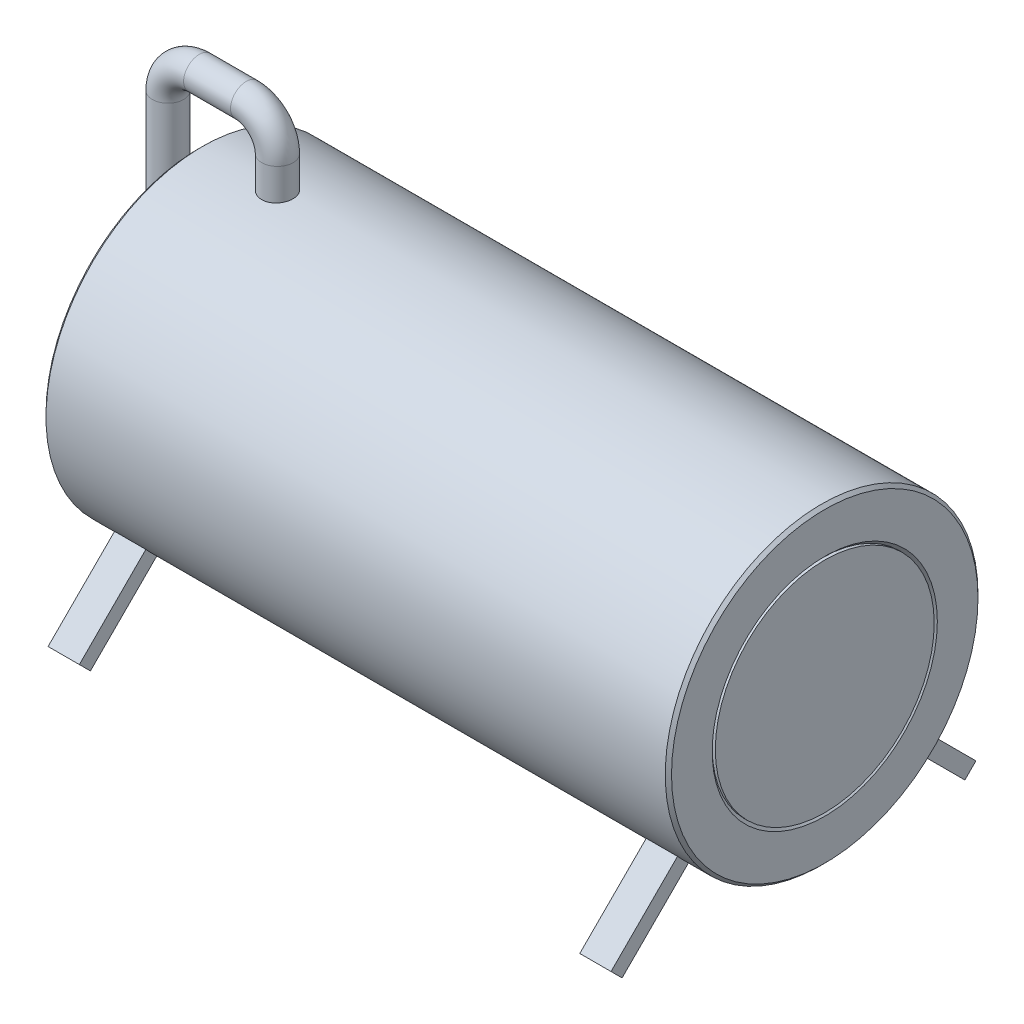
from build123d import *

# Parameters (mm, degrees)
ESBO_O1_R                                     = 50
RESSALTO_EXTRUS_O1_DEPTH                      = 200
ESBO_O2_R                                     = 35
CORTE_EXTRUS_O1_DEPTH                         = 200
ESBO_O3_W                                     = 190
ESBO_O3_H                                     = 10
CHANFRO1_SIZE                                 = 1
RESSALTO_EXTRUS_O2_DEPTH                      = 10
PADR_OCIRCULAR1_COUNT                         = 2
PADR_OCIRCULAR1_ANGLE                         = 90
PADR_O_LINEAR1_COUNT                          = 2
PADR_O_LINEAR1_PITCH                          = 170
PADR_O_LINEAR1_COPY_1_DEPTH                   = 10
BROCA_DE_ROSQUEAR_PARA_TARRAXA_DE_M10X1_REACH = 236.819
BROCA_DE_ROSQUEAR_PARA_TARRAXA_DE_M1_2_R      = 4.5
ESBO_O9_R                                     = 5
ESBO_O9_R_2                                   = 2.5
CHANFRO2_SIZE                                 = 2.5
ESBO_O10_W                                    = 5
ESBO_O10_H                                    = 35
ESBO_O14_W                                    = 5
ESBO_O14_H                                    = 30
SKETCH1_W                                     = 2.57901042
SKETCH1_H                                     = 7.592922652


with BuildPart() as part:
    # Esboço1 → Ressalto-extrusão1 (new body)
    with BuildSketch(Plane(origin=(0, 0, 0), x_dir=(0, 0, -1), z_dir=(1, 0, 0))):
        Circle(ESBO_O1_R)
    extrude(amount=RESSALTO_EXTRUS_O1_DEPTH)

    # Esboço2 → Corte-extrusão1 (cut)
    with BuildSketch(Plane(origin=(200, 0, 0), x_dir=(0, 0, -1), z_dir=(1, 0, 0))):
        Circle(ESBO_O2_R)
    extrude(amount=-CORTE_EXTRUS_O1_DEPTH, mode=Mode.SUBTRACT)

    # Esboço3 → Corte-Revolução1 (revolve, cut)
    with BuildSketch(Plane.XY, mode=Mode.PRIVATE) as corte_revolu_o1_sk:
        with Locations((100, 42.5)):
            Rectangle(ESBO_O3_W, ESBO_O3_H)
    revolve(corte_revolu_o1_sk.sketch.rotate(Axis((200, 0, 0), (-1, 0, 0)), 90), axis=Axis((200, 0, 0), (-1, 0, 0)), mode=Mode.SUBTRACT)

    # Chanfro1
    chanfro1_edges = [part.edges().sort_by_distance(p)[0] for p in [
        (0, 0, 50),
        (200, 0, 50),
        (0, 0, 35),
        (200, 0, 35),
    ]]
    chamfer(chanfro1_edges, length=CHANFRO1_SIZE)

    # Esboço4 → Ressalto-extrusão2 (add)
    with BuildSketch(Plane.ZY.offset(-10)):
        with BuildLine():
            Line((-37.078884183, -33.543350277), (-58.336309448, -54.800775542))
            Line((-58.336309448, -54.800775542), (-54.800775542, -58.336309448))
            Line((-54.800775542, -58.336309448), (-33.543350277, -37.078884183))
            ThreePointArc((-33.543350277, -37.078884183), (-35.355339059, -35.355339059), (-37.078884183, -33.543350277))
        make_face()
    ressalto_extrus_o2 = extrude(amount=-RESSALTO_EXTRUS_O2_DEPTH)

    # PadrãoCircular1: Ressalto-extrusão2 ×2 about axis
    padr_ocircular1_axis = Axis((0, 0, 0), (-1, 0, 0))
    for i in range(1, PADR_OCIRCULAR1_COUNT):
        add(ressalto_extrus_o2.rotate(padr_ocircular1_axis, i * PADR_OCIRCULAR1_ANGLE / (PADR_OCIRCULAR1_COUNT - 1)))

    # Padrão linear1: Ressalto-extrusão2 ×2
    with Locations(*[(i * PADR_O_LINEAR1_PITCH, 0, 0) for i in range(1, PADR_O_LINEAR1_COUNT)]):
        add(ressalto_extrus_o2)

    # Padrão linear1 copy 1 sketch → Padrão linear1 copy 1 (add)
    with BuildSketch(Plane(origin=(180, 0, 0), x_dir=(0, 1, 0), z_dir=(-1, 0, 0))):
        with BuildLine():
            Line((-37.078884183, -33.543350277), (-58.336309448, -54.800775542))
            Line((-58.336309448, -54.800775542), (-54.800775542, -58.336309448))
            Line((-54.800775542, -58.336309448), (-33.543350277, -37.078884183))
            ThreePointArc((-33.543350277, -37.078884183), (-35.355339059, -35.355339059), (-37.078884183, -33.543350277))
        make_face()
    extrude(amount=-PADR_O_LINEAR1_COPY_1_DEPTH)

    # Broca de rosquear para tarraxa de M1 2 → Broca de rosquear para tarraxa de M10x1.01 (cut, up to next)
    with BuildSketch(Plane(origin=(0, 50, 0), x_dir=(-1, 0, 0), z_dir=(0, 1, 0)), mode=Mode.PRIVATE) as broca_de_rosquear_para_tarraxa_de_m10x1_sk1:
        with Locations((-25, 0)):
            Circle(BROCA_DE_ROSQUEAR_PARA_TARRAXA_DE_M1_2_R)
    broca_de_rosquear_para_tarraxa_de_m10x1_tool1 = extrude(broca_de_rosquear_para_tarraxa_de_m10x1_sk1.sketch, amount=-BROCA_DE_ROSQUEAR_PARA_TARRAXA_DE_M10X1_REACH, mode=Mode.PRIVATE) & part.part
    add(broca_de_rosquear_para_tarraxa_de_m10x1_tool1.solids().sort_by_distance((25, 50, 0))[0], mode=Mode.SUBTRACT)

    # Varredura1: sweep along a path in Esboço8
    with BuildLine(Plane.XY) as varredura1_path:
        Line((25, 47.5), (25, 60))
        ThreePointArc((25, 60), (22.071067812, 67.071067812), (15, 70))
        Line((15, 70), (0, 70))
        ThreePointArc((0, 70), (-7.071067812, 67.071067812), (-10, 60))
        Line((-10, 60), (-10, 10))
        ThreePointArc((-10, 10), (-7.071067812, 2.928932188), (0, 0))
        Line((0, 0), (100, 0))
    # Esboço9 → Varredura1 (sweep)
    with BuildSketch(Plane(origin=(0, 47.5, 0), x_dir=(-1, 0, 0), z_dir=(0, 1, 0))):
        with Locations((-25, 0)):
            Circle(ESBO_O9_R)
        with Locations((-25, 0)):
            Circle(ESBO_O9_R_2, mode=Mode.SUBTRACT)
    sweep(path=varredura1_path.line)

    # Chanfro2
    chanfro2_edges = [part.edges().sort_by_distance(p)[0] for p in [
        (100, -2.5, 0),
    ]]
    chamfer(chanfro2_edges, length=CHANFRO2_SIZE - 0.0001)  # a hair under: the kernel refuses the full size

    # Esboço10 → Revolução1 (revolve)
    with BuildSketch(Plane.XY):
        with Locations((197.5, 17.5)):
            Rectangle(ESBO_O10_W, ESBO_O10_H)
    revolve(axis=Axis((200, 0, 0), (-1, 0, 0)))

    # Esboço14 → Revolução2 (revolve)
    with BuildSketch(Plane.XY, mode=Mode.PRIVATE) as revolu_o2_sk:
        with Locations((2.5, 20)):
            Rectangle(ESBO_O14_W, ESBO_O14_H)
    revolve(revolu_o2_sk.sketch.rotate(Axis((200, 0, 0), (-1, 0, 0)), 90), axis=Axis((200, 0, 0), (-1, 0, 0)))


with BuildPart() as body_2:
    # Sketch1 → Revolve2 (revolve)
    with BuildSketch(Plane.XY):
        with Locations((101.28950521, 3.796461326)):
            Rectangle(SKETCH1_W, SKETCH1_H)
    revolve(axis=Axis((100, 0, 0), (1, 0, 0)))


solid = Compound([part.part, body_2.part])
